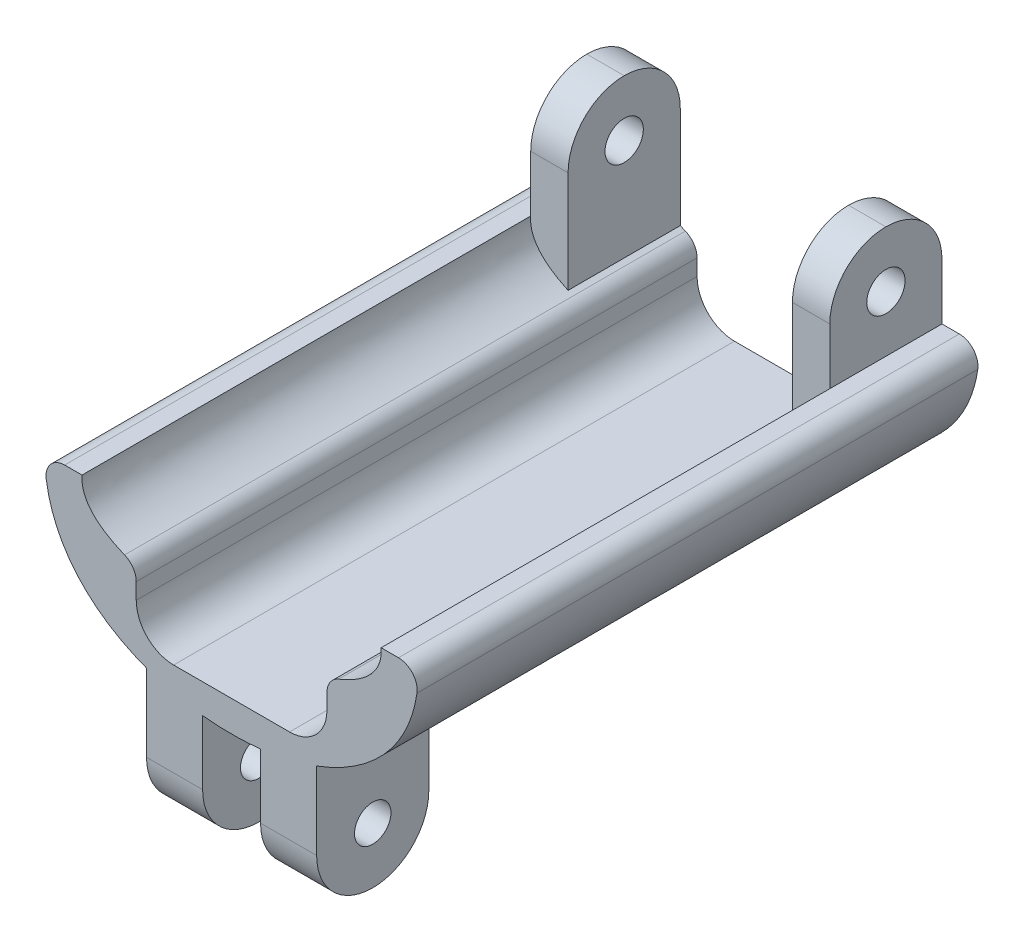
from build123d import *

# Parameters (mm, degrees)
BOSS_EXTRUDE1_DEPTH   = 30
CUT_EXTRUDE2_DEPTH    = 30
SKETCH3_W             = 2
SKETCH3_H             = 6
BOSS_EXTRUDE2_DEPTH   = 6
BOSS_EXTRUDE2_2_DEPTH = 6
SKETCH8_W             = 2
SKETCH8_H             = 6
CUT_EXTRUDE5_DEPTH    = 3
SKETCH9_W             = 2
SKETCH9_H             = 6
BOSS_EXTRUDE5_DEPTH   = 3
SKETCH5_R             = 1.025
CUT_EXTRUDE6_DEPTH    = 22
SKETCH10_W            = 3
SKETCH10_H            = 6
BOSS_EXTRUDE6_DEPTH   = 8
SKETCH11_R            = 0.975
CUT_EXTRUDE7_DEPTH    = 14
FILLET1_R             = 3
FILLET2_R             = 3
FILLET3_R             = 3
FILLET4_R             = 1


with BuildPart() as part:
    # Sketch1 → Boss-Extrude1 (new body)
    with BuildSketch(Plane.XY):
        with BuildLine():
            Line((0, 0), (2, 0))
            add(Edge.make_bspline(
                [(2, 0), (1.626861105, -4.612179168), (18.373138895, -4.721154165), (18, 0)],
                knots=[0, 0, 0, 0, 1, 1, 1, 1], degree=3))
            Line((18, 0), (20, 0))
            add(Edge.make_bspline(
                [(0, 0), (0.02488992, -10.695993841), (19.97511008, -10.637339492), (20, 0)],
                knots=[0, 0, 0, 0, 1, 1, 1, 1], degree=3))
        make_face()
    extrude(amount=BOSS_EXTRUDE1_DEPTH)

    # Sketch2 → Cut-Extrude2 (cut)
    with BuildSketch(Plane(origin=(0, 0, 0), x_dir=(-1, 0, 0), z_dir=(0, 0, -1))):
        with BuildLine():
            Line((-15.1, -2.75), (-4.9, -2.75))
            Line((-4.9, -2.75), (-4.9, -4.35))
            ThreePointArc((-4.9, -4.35), (-5.485786438, -5.764213562), (-6.9, -6.35))
            Line((-6.9, -6.35), (-13.1, -6.35))
            ThreePointArc((-13.1, -6.35), (-14.514213562, -5.764213562), (-15.1, -4.35))
            Line((-15.1, -4.35), (-15.1, -2.75))
        make_face()
    extrude(amount=-CUT_EXTRUDE2_DEPTH, mode=Mode.SUBTRACT)

    # Sketch8 → Cut-Extrude5 (cut)
    with BuildSketch(Plane.XZ):
        with Locations((3, 3)):
            Rectangle(SKETCH8_W, SKETCH8_H)
        with Locations((17, 3)):
            Rectangle(SKETCH8_W, SKETCH8_H)
    extrude(amount=CUT_EXTRUDE5_DEPTH, mode=Mode.SUBTRACT)

    # Sketch10 → Boss-Extrude6 (add)
    with BuildSketch(Plane(origin=(0, -6.35, 0), x_dir=(1, 0, 0), z_dir=(0, 1, 0))):
        with Locations((13.05, -27)):
            Rectangle(SKETCH10_W, SKETCH10_H)
        with Locations((6.95, -27)):
            Rectangle(SKETCH10_W, SKETCH10_H)
    extrude(amount=-BOSS_EXTRUDE6_DEPTH)

    # Sketch11 → Cut-Extrude7 (cut)
    with BuildSketch(Plane(origin=(14.55, 0, 0), x_dir=(0, 0, -1), z_dir=(1, 0, 0))):
        with Locations((-27, -11.35)):
            Circle(SKETCH11_R)
    extrude(amount=-CUT_EXTRUDE7_DEPTH, mode=Mode.SUBTRACT)

    # Fillet3
    fillet3_edges = [part.edges().sort_by_distance(p)[0] for p in [
        (13.05, -14.35, 30),
        (13.05, -14.35, 24),
        (6.95, -14.35, 24),
        (6.95, -14.35, 30),
    ]]
    fillet(fillet3_edges, radius=FILLET3_R - 0.0001)  # a hair under: the kernel refuses the full size

    # Fillet4
    fillet4_edges = [part.edges().sort_by_distance(p)[0] for p in [
        (20, 0, 15),
        (0, 0, 15),
        (15.1, -2.817474899, 15),
        (4.9, -2.788263927, 15),
    ]]
    fillet(fillet4_edges, radius=FILLET4_R)


with BuildPart() as body_2:
    # Sketch3 → Boss-Extrude2 (new body)
    with BuildSketch(Plane(origin=(0, 0, 0), x_dir=(1, 0, 0), z_dir=(0, 1, 0))):
        with Locations((3, -3)):
            Rectangle(SKETCH3_W, SKETCH3_H)
    extrude(amount=BOSS_EXTRUDE2_DEPTH)



with BuildPart() as body_3:
    # Sketch3 → Boss-Extrude2 2 (new body)
    with BuildSketch(Plane(origin=(0, 0, 0), x_dir=(1, 0, 0), z_dir=(0, 1, 0))):
        with Locations((17, -3)):
            Rectangle(SKETCH3_W, SKETCH3_H)
    extrude(amount=BOSS_EXTRUDE2_2_DEPTH)


with BuildPart() as body_2_1:
    add(body_2.part)

    add(body_3.part)  # Boss-Extrude5 merges body 3
    # Sketch9 → Boss-Extrude5 (add)
    with BuildSketch(Plane(origin=(0, -3, 0), x_dir=(1, 0, 0), z_dir=(0, 1, 0))):
        with Locations((3, -3)):
            Rectangle(SKETCH9_W, SKETCH9_H)
        with Locations((17, -3)):
            Rectangle(SKETCH9_W, SKETCH9_H)
    extrude(amount=BOSS_EXTRUDE5_DEPTH)

    # Sketch5 → Cut-Extrude6 (cut)
    with BuildSketch(Plane(origin=(20, 0, 0), x_dir=(0, 0, -1), z_dir=(1, 0, 0))):
        with Locations(Location((-3, 3, 0), (0, 0, 90))):
            Circle(SKETCH5_R)
    extrude(amount=-CUT_EXTRUDE6_DEPTH, mode=Mode.SUBTRACT)

    # Fillet1
    fillet1_edges = [body_2_1.edges().sort_by_distance(p)[0] for p in [
        (17, 6, 6),
        (17, 6, 0),
    ]]
    fillet(fillet1_edges, radius=FILLET1_R - 0.0001)  # a hair under: the kernel refuses the full size

    # Fillet2
    fillet2_edges = [body_2_1.edges().sort_by_distance(p)[0] for p in [
        (3, 6, 0),
        (3, 6, 6),
    ]]
    fillet(fillet2_edges, radius=FILLET2_R - 0.0001)  # a hair under: the kernel refuses the full size


solid = Compound([part.part, body_2_1.part])
